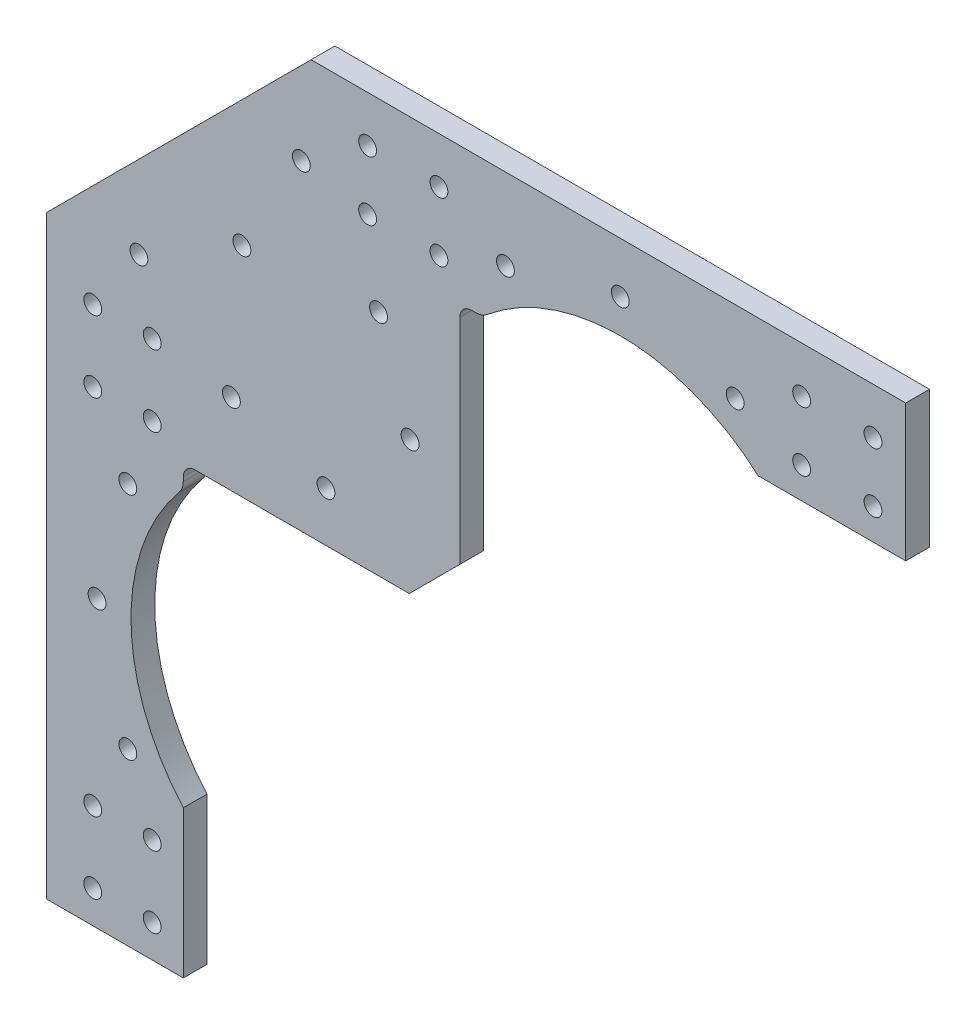
from build123d import *

# Parameters (mm, degrees)
BOSS_EXTRUDE1_DEPTH = 4
SKETCH3_R           = 1.5
CUT_EXTRUDE1_DEPTH  = 10
SKETCH4_R           = 1.5
CUT_EXTRUDE2_DEPTH  = 137.530216436


with BuildPart() as part:
    # Sketch1 → Boss-Extrude1 (new body)
    with BuildSketch(Plane.XY):
        with BuildLine():
            Line((-96.5, -48), (-73.5, -48))
            Line((-73.5, -48), (-73.5, -23.206895527))
            ThreePointArc((-73.5, -23.206895527), (-82.295939504, -0.533121187), (-74.194736842, 22.398060858))
            ThreePointArc((-74.194736842, 22.398060858), (-73.679025924, 23.297059075), (-73.5, 24.317894646))
            Line((-73.5, 24.317894646), (-73.5, 25))
            ThreePointArc((-73.5, 25), (-72.914213562, 26.414213562), (-71.5, 27))
            Line((-71.5, 27), (-35.485281374, 27))
            Line((-35.485281374, 27), (-27, 35.485281374))
            Line((-27, 35.485281374), (-27, 71.5))
            ThreePointArc((-27, 71.5), (-26.414213562, 72.914213562), (-25, 73.5))
            Line((-25, 73.5), (-24.317894646, 73.5))
            ThreePointArc((-24.317894646, 73.5), (-23.297059075, 73.679025924), (-22.398060858, 74.194736842))
            ThreePointArc((-22.398060858, 74.194736842), (0.533121187, 82.295939504), (23.206895527, 73.5))
            Line((23.206895527, 73.5), (48, 73.5))
            Line((48, 73.5), (48, 96.5))
            Line((48, 96.5), (-52, 96.5))
            Line((-52, 96.5), (-96.5, 52))
            Line((-96.5, 52), (-96.5, -48))
        make_face()
    extrude(amount=BOSS_EXTRUDE1_DEPTH)

    # Sketch3 → Cut-Extrude1 (cut)
    with BuildSketch(Plane.XY.offset(4)):
        with Locations((30.5, 78.72592343)):
            Circle(SKETCH3_R)
        with Locations((30.5, 88.72592343)):
            Circle(SKETCH3_R)
        with Locations((42.5, 88.72592343)):
            Circle(SKETCH3_R)
        with Locations((42.5, 78.72592343)):
            Circle(SKETCH3_R)
        with Locations((-42.5, 78.72592343)):
            Circle(SKETCH3_R)
        with Locations((-42.5, 88.72592343)):
            Circle(SKETCH3_R)
        with Locations((-30.5, 88.72592343)):
            Circle(SKETCH3_R)
        with Locations((-30.5, 78.72592343)):
            Circle(SKETCH3_R)
        with Locations((-88.72592343, 30.5)):
            Circle(SKETCH3_R)
        with Locations((-88.72592343, 42.5)):
            Circle(SKETCH3_R)
        with Locations((-78.72592343, 42.5)):
            Circle(SKETCH3_R)
        with Locations((-78.72592343, 30.5)):
            Circle(SKETCH3_R)
        with Locations((-88.72592343, -42.5)):
            Circle(SKETCH3_R)
        with Locations((-88.72592343, -30.5)):
            Circle(SKETCH3_R)
        with Locations((-78.72592343, -30.5)):
            Circle(SKETCH3_R)
        with Locations((-78.72592343, -42.5)):
            Circle(SKETCH3_R)
    extrude(amount=-CUT_EXTRUDE1_DEPTH, mode=Mode.SUBTRACT)

    # Sketch4 → Cut-Extrude2 (cut, through all)
    with BuildSketch(Plane.XY.offset(4)):
        with Locations((-88, 0)):
            Circle(SKETCH4_R)
        with Locations((-63.639610307, 63.639610307)):
            Circle(SKETCH4_R)
        with Locations((0, 88)):
            Circle(SKETCH4_R)
        with Locations((-80.960118382, 53.639610307)):
            Circle(SKETCH4_R)
        with Locations((-53.639610307, 80.960118382)):
            Circle(SKETCH4_R)
        with Locations((19.318516526, 82.823619098)):
            Circle(SKETCH4_R)
        with Locations((-19.318516526, 82.823619098)):
            Circle(SKETCH4_R)
        with Locations((-82.823619098, 19.318516526)):
            Circle(SKETCH4_R)
        with Locations((-82.823619098, -19.318516526)):
            Circle(SKETCH4_R)
        with Locations((-40.658639918, 65.40737726)):
            Circle(SKETCH4_R)
        with Locations((-65.40737726, 40.658639918)):
            Circle(SKETCH4_R)
        with Locations((-49.497474683, 35.355339059)):
            Circle(SKETCH4_R)
        with Locations((-35.355339059, 49.497474683)):
            Circle(SKETCH4_R)
    extrude(amount=-CUT_EXTRUDE2_DEPTH, mode=Mode.SUBTRACT)


solid = part.part
